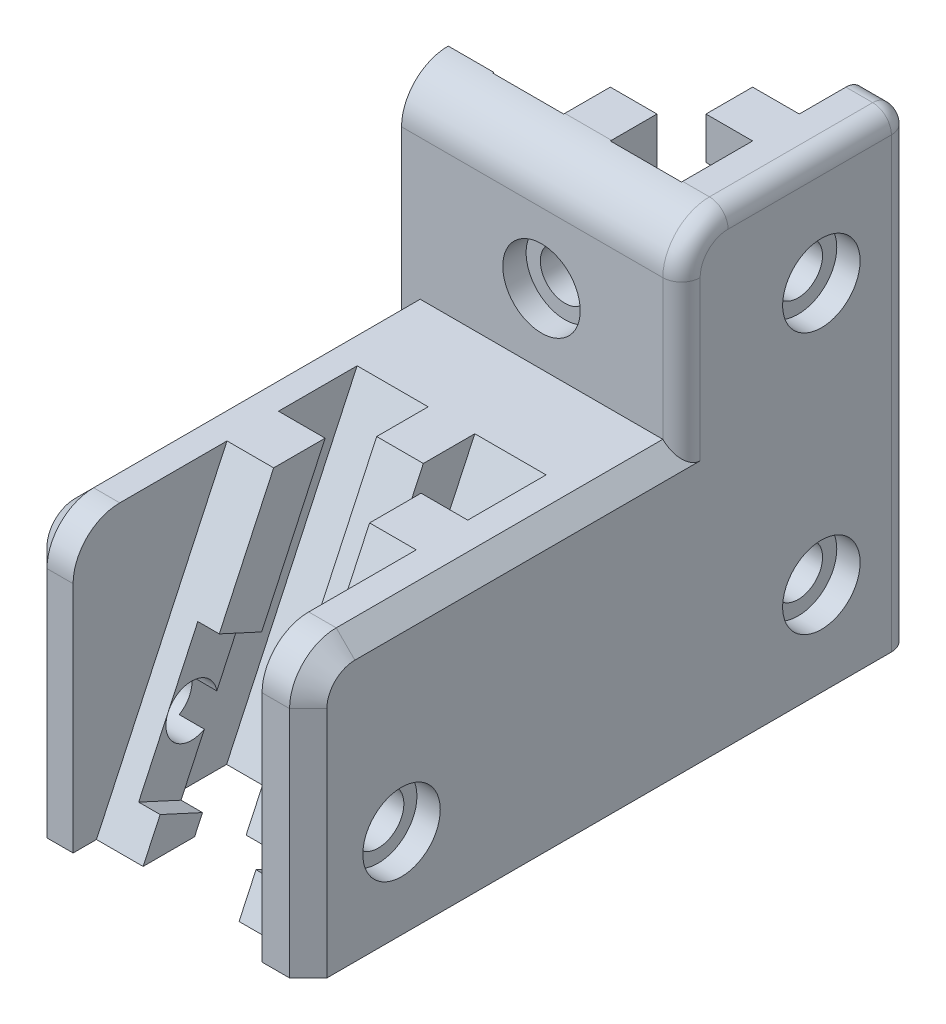
from build123d import *

# Parameters (mm, degrees)
Z_EXTRUSION_MOUNT_W     = 30
Z_EXTRUSION_MOUNT_H     = 30
BOSS_EXTRUDE1_DEPTH     = 50
CUT_EXTRUDE1_DEPTH      = 50
SKETCH3_W               = 30
SKETCH3_H               = 5.505679799
CUT_EXTRUDE3_DEPTH      = 50
SKETCH4_W               = 30
SKETCH4_H               = 30
BOSS_EXTRUDE3_DEPTH     = 40
CUT_EXTRUDE4_DEPTH      = 10
CUT_EXTRUDE4_DEPTH_BACK = 62.479626952
FILLET1_R               = 5
FILLET2_R               = 5
SKETCH11_R              = 2.75
CUT_EXTRUDE14_DEPTH     = 30
SKETCH22_R              = 4.15
CUT_EXTRUDE17_DEPTH     = 2.5
CUT_EXTRUDE18_START     = -2.5
SKETCH23_R              = 4.15
CUT_EXTRUDE18_DEPTH     = 2.5
FILLET4_R               = 2
SKETCH24_W              = 4.875
SKETCH24_H              = 19.494320201
CUT_EXTRUDE19_DEPTH     = 76.828754441
SKETCH25_R              = 2.625
CUT_EXTRUDE20_DEPTH     = 81.156097709
SKETCH26_R              = 4.15
CUT_EXTRUDE21_DEPTH     = 2.5
SKETCH27_R              = 2.625
CUT_EXTRUDE23_DEPTH     = 66.76473219
SKETCH28_R              = 4.15
CUT_EXTRUDE24_DEPTH     = 2.5
SKETCH29_W              = 10
SKETCH29_H              = 15
CUT_EXTRUDE25_DEPTH     = 3
SKETCH31_W              = 10
SKETCH31_H              = 15
CUT_EXTRUDE27_DEPTH     = 3
SKETCH33_W              = 20.25
SKETCH33_H              = 10.783419854
CUT_EXTRUDE29_DEPTH     = 62.479626952
CUT_EXTRUDE30_DEPTH     = 7.5
CHAMFER1_SIZE           = 2
FILLET5_R               = 2


with BuildPart() as part:
    # Z extrusion mount → Boss-Extrude1 (new body)
    with BuildSketch(Plane(origin=(0, 0, 0), x_dir=(1, 0, 0), z_dir=(0, 1, 0))):
        Rectangle(Z_EXTRUSION_MOUNT_W, Z_EXTRUSION_MOUNT_H)
    extrude(amount=BOSS_EXTRUDE1_DEPTH)

    # Sketch2 → Cut-Extrude1 (cut)
    with BuildSketch(Plane(origin=(0, 50, 0), x_dir=(1, 0, 0), z_dir=(0, 1, 0))):
        Polygon((-10.125, 10.125), (-10.125, -10.125), (-2.5, -10.125), (-2.5, -5.125), (2.5, -5.125), (2.5, -10.125), (10.125, -10.125), (10.125, -2.5), (5.125, -2.5), (5.125, 2.5), (10.125, 2.5), (10.125, 10.125), align=None)
    extrude(amount=-CUT_EXTRUDE1_DEPTH, mode=Mode.SUBTRACT)

    # Sketch3 → Cut-Extrude3 (cut)
    with BuildSketch(Plane(origin=(0, 50, 0), x_dir=(1, 0, 0), z_dir=(0, 1, 0))):
        with Locations((0, 12.247160101)):
            Rectangle(SKETCH3_W, SKETCH3_H)
    extrude(amount=-CUT_EXTRUDE3_DEPTH, mode=Mode.SUBTRACT)

    # Sketch4 → Boss-Extrude3 (add)
    with BuildSketch(Plane.XY.offset(15)):
        with Locations((0, 15)):
            Rectangle(SKETCH4_W, SKETCH4_H)
    extrude(amount=BOSS_EXTRUDE3_DEPTH)

    # Sketch12 → Cut-Extrude4 (cut, two sides: drawn at the far end of the back side and taken through both)
    with BuildSketch(Plane(origin=(-15, 30, 35), x_dir=(-1, 0, 0), z_dir=(0, 0.9063077870366478, -0.42261826174070405)).offset(-CUT_EXTRUDE4_DEPTH_BACK)):
        Polygon((-25.051676804, -1.850953689), (-25.051676804, -9.461830913), (-17.412554028, -9.461830913), (-17.412554028, -4.461830913), (-12.412554028, -4.461830913), (-12.412554028, -9.461830913), (-4.801676804, -9.461830913), (-4.801676804, -1.822708137), (-9.801676804, -1.822708137), (-9.801676804, 3.177291863), (-4.801676804, 3.177291863), (-4.801676804, 10.788169087), (-12.440799581, 10.788169087), (-12.440799581, 5.788169087), (-17.440799581, 5.788169087), (-17.440799581, 10.788169087), (-25.051676804, 10.788169087), (-25.051676804, 3.149046311), (-20.051676804, 3.149046311), (-20.051676804, -1.850953689), align=None)
    extrude(amount=CUT_EXTRUDE4_DEPTH + CUT_EXTRUDE4_DEPTH_BACK, mode=Mode.SUBTRACT)

    # Fillet1
    fillet1_edges = [part.edges().sort_by_distance(p)[0] for p in [
        (0, 30, 55),
    ]]
    fillet(fillet1_edges, radius=FILLET1_R)

    # Fillet2
    # the kernel refuses this fillet: 5 mm, written as the material it takes off along each edge
    with BuildSketch(Plane(origin=(-27.5, 50, 15), x_dir=(0, -1, 0), z_dir=(1, 0, 0))) as fillet2_piece_1:
        with BuildLine():
            CenterArc((FILLET2_R, FILLET2_R), FILLET2_R, 180, 90)
            Line((0, FILLET2_R), (0, 0))
            Line((0, 0), (FILLET2_R, 0))
        make_face()
    extrude(amount=55, mode=Mode.SUBTRACT)

    # Sketch11 → Cut-Extrude14 (cut)
    with BuildSketch(Plane.ZY.offset(15)):
        with Locations((45, 9.554930795)):
            Circle(SKETCH11_R)
    extrude(amount=-CUT_EXTRUDE14_DEPTH, mode=Mode.SUBTRACT)

    # Sketch22 → Cut-Extrude17 (cut)
    with BuildSketch(Plane(origin=(15, 0, 0), x_dir=(0, 0, -1), z_dir=(1, 0, 0))):
        with Locations((-45, 9.554930795)):
            Circle(SKETCH22_R)
    extrude(amount=-CUT_EXTRUDE17_DEPTH, mode=Mode.SUBTRACT)

    # Sketch23 → Cut-Extrude18 (cut)
    with BuildSketch(Plane.ZY.offset(15).offset(CUT_EXTRUDE18_START)):
        with Locations(Location((45, 9.554930795, 0), (0, 0, 180))):
            Circle(SKETCH23_R)
    extrude(amount=CUT_EXTRUDE18_DEPTH, mode=Mode.SUBTRACT)

    # Fillet4
    fillet4_edges = [part.edges().sort_by_distance(p)[0] for p in [
        (15, 50, 0.252839899),
        (15, 48.535533906, 13.535533906),
        (15, 37.5, 15),
    ]]
    fillet(fillet4_edges, radius=FILLET4_R)

    # Sketch24 → Cut-Extrude19 (cut, through all)
    with BuildSketch(Plane(origin=(0, 50, 0), x_dir=(1, 0, 0), z_dir=(0, 1, 0))):
        with Locations((-12.5625, -0.252839899)):
            Rectangle(SKETCH24_W, SKETCH24_H)
    extrude(amount=-CUT_EXTRUDE19_DEPTH, mode=Mode.SUBTRACT)

    # Sketch25 → Cut-Extrude20 (cut, through all)
    with BuildSketch(Plane(origin=(15, 0, 0), x_dir=(0, 0, -1), z_dir=(1, 0, 0))):
        with Locations((-0.005679799, 38)):
            Circle(SKETCH25_R)
        with Locations((-0.005679799, 10)):
            Circle(SKETCH25_R)
    extrude(amount=-CUT_EXTRUDE20_DEPTH, mode=Mode.SUBTRACT)

    # Sketch26 → Cut-Extrude21 (cut)
    with BuildSketch(Plane(origin=(15, 0, 0), x_dir=(0, 0, -1), z_dir=(1, 0, 0))):
        with Locations((-0.005679799, 38)):
            Circle(SKETCH26_R)
        with Locations((-0.005679799, 10)):
            Circle(SKETCH26_R)
    extrude(amount=-CUT_EXTRUDE21_DEPTH, mode=Mode.SUBTRACT)

    # Sketch27 → Cut-Extrude23 (cut, through all)
    with BuildSketch(Plane.XY.offset(15)):
        with Locations((0, 37.5)):
            Circle(SKETCH27_R)
    extrude(amount=-CUT_EXTRUDE23_DEPTH, mode=Mode.SUBTRACT)

    # Sketch28 → Cut-Extrude24 (cut)
    with BuildSketch(Plane.XY.offset(15)):
        with Locations((0, 37.5)):
            Circle(SKETCH28_R)
    extrude(amount=-CUT_EXTRUDE24_DEPTH, mode=Mode.SUBTRACT)

    # Sketch29 → Cut-Extrude25 (cut)
    with BuildSketch(Plane(origin=(0, 0, 5.125), x_dir=(-1, 0, 0), z_dir=(0, 0, -1))):
        with Locations((0, 37.5)):
            Rectangle(SKETCH29_W, SKETCH29_H)
    extrude(amount=-CUT_EXTRUDE25_DEPTH, mode=Mode.SUBTRACT)

    # Sketch31 → Cut-Extrude27 (cut)
    with BuildSketch(Plane.ZY.offset(-5.125)):
        with Locations((0.005679799, 38)):
            Rectangle(SKETCH31_W, SKETCH31_H)
        with Locations((0.005679799, 10)):
            Rectangle(SKETCH31_W, SKETCH31_H)
    extrude(amount=-CUT_EXTRUDE27_DEPTH, mode=Mode.SUBTRACT)

    # Sketch33 → Cut-Extrude29 (cut, through all)
    with BuildSketch(Plane(origin=(-15, 30, 35), x_dir=(-1, 0, 0), z_dir=(0, 0.9063077870366478, -0.42261826174070405))):
        with Locations((-14.926676804, 11.08981557)):
            Rectangle(SKETCH33_W, SKETCH33_H)
    extrude(amount=-CUT_EXTRUDE29_DEPTH, mode=Mode.SUBTRACT)

    # Sketch35 → Cut-Extrude30 (cut, symmetric)
    with BuildSketch(Plane(origin=(0, 0, 0), x_dir=(0, 0, -1), z_dir=(1, 0, 0))):
        Polygon((-37.747378495, 14.475156436), (-45.033706868, 17.825136051), (-52.252621505, 4.634705153), (-44.966293132, 1.284725539), align=None)
    extrude(amount=CUT_EXTRUDE30_DEPTH, both=True, mode=Mode.SUBTRACT)

    # Chamfer1
    chamfer1_edges = [part.edges().sort_by_distance(p)[0] for p in [
        (15, 12.5, 55),
        (15, 28.535533906, 53.535533906),
        (15, 30, 31.5),
        (-15, 12.5, 55),
        (-15, 28.535533906, 53.535533906),
        (-15, 30, 32.5),
    ]]
    chamfer(chamfer1_edges, length=CHAMFER1_SIZE)

    # Fillet5
    fillet5_edges = [part.edges().sort_by_distance(p)[0] for p in [
        (14.414213562, 49.414213562, -9.494320201),
        (15, 24, -9.494320201),
        (11.5625, 50, -9.494320201),
    ]]
    fillet(fillet5_edges, radius=FILLET5_R)


solid = part.part
